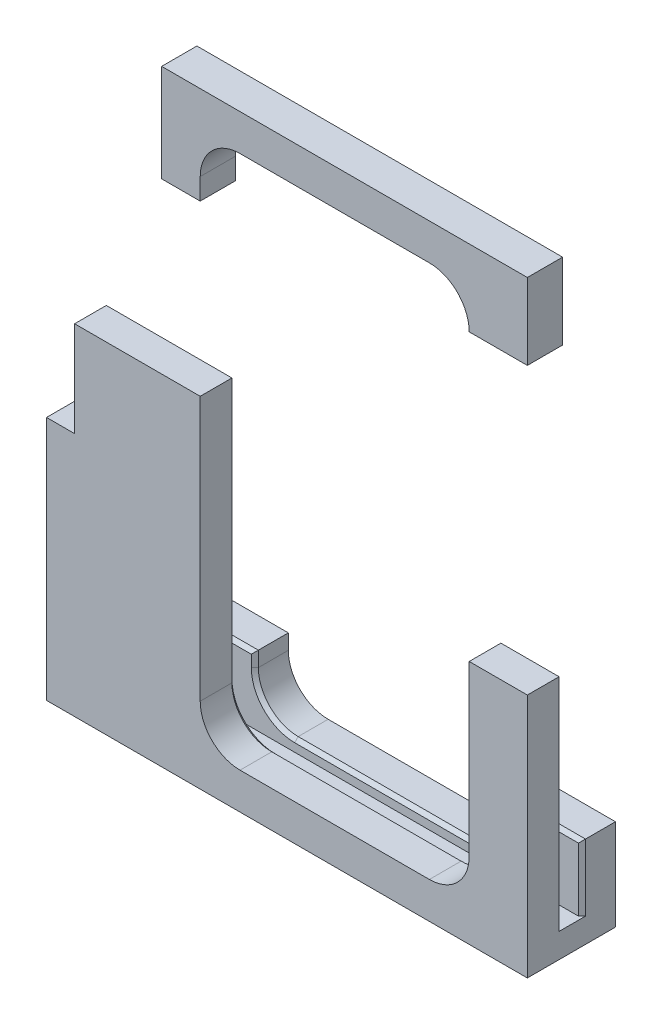
from build123d import *

# Parameters (mm, degrees)
BOSS_EXTRUDE1_DEPTH = 10
BOSS_EXTRUDE2_START = -15
BOSS_EXTRUDE2_DEPTH = 15
CUT_EXTRUDE2_START  = -25
CUT_EXTRUDE2_DEPTH  = 25
SKETCH9_W           = 12.32377621
SKETCH9_H           = 20.190011783
SKETCH9_W_2         = 8.082915928
SKETCH9_H_2         = 19.897693181
SKETCH9_W_3         = 27.099227996
SKETCH9_H_3         = 21.612440871
SKETCH9_H_4         = 69.53388311
CUT_EXTRUDE3_DEPTH  = 51
SKETCH11_W          = 24.481918607
SKETCH11_H          = 43.634366614
BOSS_EXTRUDE4_DEPTH = 15
CAVITY3_START       = -5.5
CAVITY3_DEPTH       = 5.5
CUT_EXTRUDE4_DEPTH  = 10
SKETCH16_W          = 35.640039366
SKETCH16_H          = 10
BOSS_EXTRUDE8_DEPTH = 27
CHAMFER1_SIZE       = 1


# Read off the part's stored shape, not the designer's step: Cavity3
with BuildPart() as part:
    # Sketch2 → Boss-Extrude1 (new body)
    with BuildSketch(Plane.XY):
        with BuildLine():
            ThreePointArc((-69.025908971, 64.455), (-65.804083564, 72.233174593), (-58.025908971, 75.455))
            Line((-58.025908971, 75.455), (-4.305908971, 75.455))
            ThreePointArc((-4.305908971, 75.455), (3.472265622, 72.233174593), (6.694091029, 64.455))
            Line((6.694091029, 64.455), (50.59484207, 64.455))
            Line((50.59484207, 64.455), (50.59484207, 86.067440871))
            Line((50.59484207, 86.067440871), (-112.926660012, 86.067440871))
            Line((-112.926660012, 86.067440871), (-112.926660012, -86.067440871))
            Line((-112.926660012, -86.067440871), (50.59484207, -86.067440871))
            Line((50.59484207, -86.067440871), (50.59484207, -16.533557761))
            Line((50.59484207, -16.533557761), (6.694091029, -16.533557761))
            Line((6.694091029, -16.533557761), (6.694091029, -64.455))
            ThreePointArc((6.694091029, -64.455), (3.472265622, -72.233174593), (-4.305908971, -75.455))
            Line((-4.305908971, -75.455), (-58.025908971, -75.455))
            ThreePointArc((-58.025908971, -75.455), (-65.804083564, -72.233174593), (-69.025908971, -64.455))
            Line((-69.025908971, -64.455), (-69.025908971, 16.297314801))
            Line((-69.025908971, 16.297314801), (6.694091029, 16.297314801))
            Line((6.694091029, 16.297314801), (6.694091029, 33.387471945))
            Line((6.694091029, 33.387471945), (-69.025908971, 33.387471945))
            Line((-69.025908971, 33.387471945), (-69.025908971, 64.455))
        make_face()
    extrude(amount=BOSS_EXTRUDE1_DEPTH)

    # Sketch2<3> → Boss-Extrude2 (add)
    with BuildSketch(Plane.XY.offset(BOSS_EXTRUDE2_START)):
        with BuildLine():
            Line((-69.025908971, -60.167924375), (-112.926660012, -60.167924375))
            Line((-112.926660012, -60.167924375), (-112.926660012, -86.067440871))
            Line((-112.926660012, -86.067440871), (50.59484207, -86.067440871))
            Line((50.59484207, -86.067440871), (50.59484207, -60.167924375))
            Line((50.59484207, -60.167924375), (6.694091029, -60.167924375))
            Line((6.694091029, -60.167924375), (6.694091029, -64.455))
            ThreePointArc((6.694091029, -64.455), (3.472265622, -72.233174593), (-4.305908971, -75.455))
            Line((-4.305908971, -75.455), (-58.025908971, -75.455))
            ThreePointArc((-58.025908971, -75.455), (-65.804083564, -72.233174593), (-69.025908971, -64.455))
            Line((-69.025908971, -64.455), (-69.025908971, -60.167924375))
        make_face()
    extrude(amount=BOSS_EXTRUDE2_DEPTH)

    # Sketch7 → Cut-Extrude2 (cut)
    with BuildSketch(Plane.XY.offset(10).offset(CUT_EXTRUDE2_START)):
        with BuildLine():
            Line((-69.325908971, 33.387471945), (-69.325908971, 16.297314801))
            Line((-69.325908971, 16.297314801), (-69.325908971, -64.455))
            ThreePointArc((-69.325908971, -64.455), (-66.016215599, -72.445306627), (-58.025908971, -75.755))
            Line((-58.025908971, -75.755), (-4.305908971, -75.755))
            ThreePointArc((-4.305908971, -75.755), (3.684397656, -72.445306627), (6.994091029, -64.455))
            Line((6.994091029, -64.455), (6.994091029, -16.533557761))
            Line((6.994091029, -16.533557761), (6.994091029, 64.455))
            ThreePointArc((6.994091029, 64.455), (3.684397656, 72.445306627), (-4.305908971, 75.755))
            Line((-4.305908971, 75.755), (-58.025908971, 75.755))
            ThreePointArc((-58.025908971, 75.755), (-66.016215599, 72.445306627), (-69.325908971, 64.455))
            Line((-69.325908971, 64.455), (-69.325908971, 33.387471945))
        make_face()
    extrude(amount=CUT_EXTRUDE2_DEPTH, mode=Mode.SUBTRACT)

    # Sketch9 → Cut-Extrude3 (cut)
    with BuildSketch(Plane.XY.offset(10)):
        with Locations((-106.764771907, 13.459141312)):
            Rectangle(SKETCH9_W, SKETCH9_H)
        with Locations((-116.968117976, 13.459141312)):
            Rectangle(SKETCH9_W_2, SKETCH9_H)
        Polygon((-122.798498513, -16.533557761), (-112.926660012, -16.533557761), (-112.926660012, 3.36413542), (-121.00957594, 3.36413542), (-121.00957594, 23.554147203), (-122.798498513, 23.554147203), align=None)
        with Locations((-106.764771907, -6.584711171)):
            Rectangle(SKETCH9_W, SKETCH9_H_2)
        Polygon((-100.602883802, 23.554147203), (-100.602883802, 3.36413542), (-80.261895125, 3.36413542), (-80.261895125, 86.067440871), (-112.926660012, 86.067440871), (-112.926660012, 23.554147203), align=None)
        Polygon((50.59484207, -86.067440871), (23.495614074, -86.067440871), (23.495614074, -98.291356894), (80.343598041, -98.291356894), (80.343598041, 92.328281653), (23.495614074, 92.328281653), (23.495614074, 86.067440871), (50.59484207, 86.067440871), (50.59484207, 64.455), (23.495614074, 64.455), (23.495614074, -16.533557761), (50.59484207, -16.533557761), align=None)
        with Locations((37.045228072, 75.261220436)):
            Rectangle(SKETCH9_W_3, SKETCH9_H_3)
        with Locations((37.045228072, -51.300499316)):
            Rectangle(SKETCH9_W_3, SKETCH9_H_4)
    extrude(amount=-CUT_EXTRUDE3_DEPTH, mode=Mode.SUBTRACT)

    # Sketch11 → Boss-Extrude4 (add)
    with BuildSketch(Plane(origin=(0, 0, 0), x_dir=(-1, 0, 0), z_dir=(0, 0, -1))):
        with Locations((100.685700709, -38.350741068)):
            Rectangle(SKETCH11_W, SKETCH11_H)
    extrude(amount=BOSS_EXTRUDE4_DEPTH)

    # Cavity3 outline → Cavity3 (cut)
    with BuildSketch(Plane.XY.offset(CAVITY3_START)):
        with BuildLine():
            Line((-104.965948337, -79.115579866), (23.495614074, -79.115579866))
            Line((23.495614074, -79.115579866), (23.495614074, -60.167924375))
            Line((23.495614074, -60.167924375), (6.994091029, -60.167924375))
            Line((6.994091029, -60.167924375), (6.994091029, -64.455))
            ThreePointArc((6.994091029, -64.455), (3.684397656, -72.445306627), (-4.305908971, -75.755))
            Line((-4.305908971, -75.755), (-58.025908971, -75.755))
            ThreePointArc((-58.025908971, -75.755), (-66.016215598, -72.445306628), (-69.325908971, -64.455))
            Line((-69.325908971, -64.455), (-69.325908971, -60.167924375))
            Line((-69.325908971, -60.167924375), (-88.444741405, -60.167924375))
            Line((-88.444741405, -60.167924375), (-88.444741405, -16.533557761))
            Line((-88.444741405, -16.533557761), (-104.965948337, -16.533557761))
            Line((-104.965948337, -16.533557761), (-104.965948337, -79.115579866))
        make_face()
    extrude(amount=CAVITY3_DEPTH, mode=Mode.SUBTRACT)

    # Sketch14 → Cut-Extrude4 (cut)
    with BuildSketch(Plane.XY.offset(10)):
        with BuildLine():
            Line((-100.172122713, 9.640304973), (-55.174695682, 9.640304973))
            Line((-55.174695682, 9.640304973), (-55.174695682, 58.414674309))
            Line((-55.174695682, 58.414674309), (-93.172122713, 58.414674309))
            ThreePointArc((-93.172122713, 58.414674309), (-98.121870182, 56.364421777), (-100.172122713, 51.414674309))
            Line((-100.172122713, 51.414674309), (-100.172122713, 9.640304973))
        make_face()
    extrude(amount=-CUT_EXTRUDE4_DEPTH, mode=Mode.SUBTRACT)


with BuildPart() as cut_extrude4_piece_1:
    # of the separate pieces the step leaves, piece 1, a body of its own (cut_extrude4_pieces)
    add(part.part.solids().sort_by_distance((-100.602883802, -16.533557761, 0))[0])

    # Sketch16 → Boss-Extrude8 (add)
    with BuildSketch(Plane(origin=(0, -16.533557761, 0), x_dir=(1, 0, 0), z_dir=(0, 1, 0))):
        with Locations((-87.145928654, -5)):
            Rectangle(SKETCH16_W, SKETCH16_H)
    extrude(amount=BOSS_EXTRUDE8_DEPTH)

    # Chamfer1
    chamfer1_edges = [cut_extrude4_piece_1.edges().sort_by_distance(p)[0] for p in [
        (-78.885325188, -60.167924375, -5.5),
        (-69.325908971, -26.99427888, 0),
        (-66.016215598, -72.445306628, 0),
        (-31.165908971, -75.755, 0),
        (3.684397656, -72.445306627, 0),
        (6.994091029, -38.350741068, 0),
        (15.244852551, -16.533557761, 0),
        (23.495614074, -47.824568813, 0),
        (15.244852551, -60.167924375, -5.5),
        (-69.325908971, -62.311462187, -5.5),
        (3.684397656, -72.445306627, -5.5),
        (-87.145928654, 10.466442239, 0),
        (-31.165908971, -75.755, -5.5),
        (-66.016215598, -72.445306628, -5.5),
        (6.994091029, -62.311462187, -5.5),
        (23.495614074, -69.641752121, -5.5),
        (-88.444741405, -38.350741068, -5.5),
    ]]
    chamfer(chamfer1_edges, length=CHAMFER1_SIZE)


with BuildPart() as cut_extrude4_piece_2:
    # of the separate pieces the step leaves, piece 2, a body of its own (cut_extrude4_pieces)
    add(part.part.solids().sort_by_distance((-80.261895125, 58.414674309, 0))[0])


solid = Compound([cut_extrude4_piece_1.part, cut_extrude4_piece_2.part])
